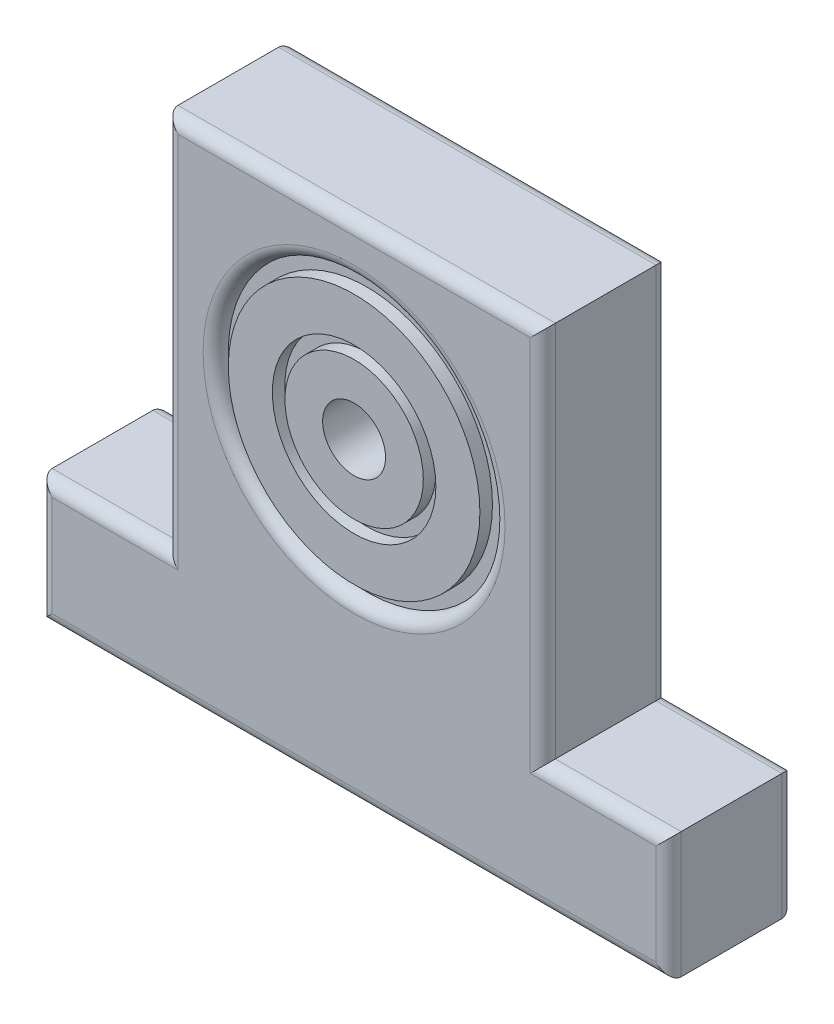
from build123d import *

# Parameters (mm, degrees)
SKETCH1_R           = 2.5
BOSS_EXTRUDE1_DEPTH = 10
SKETCH2_R           = 11
SKETCH2_R_2         = 10
SKETCH2_R_3         = 6.5
SKETCH2_R_4         = 5.5
CUT_EXTRUDE1_DEPTH  = 1
FILLET1_R           = 1


with BuildPart() as part:
    # Sketch1 → Boss-Extrude1 (new body)
    with BuildSketch(Plane.XY):
        Polygon((0, 0), (50, 0), (50, 10), (40, 10), (40, 40), (10, 40), (10, 10), (0, 10), align=None)
        with Locations((25, 25)):
            Circle(SKETCH1_R, mode=Mode.SUBTRACT)
    extrude(amount=BOSS_EXTRUDE1_DEPTH)

    # Sketch2 → Cut-Extrude1 (cut)
    # profile 1 of 2: a face of its own
    with BuildSketch(Plane.XY.offset(10)):
        with Locations((25, 25)):
            Circle(SKETCH2_R)
        with Locations((25, 25)):
            Circle(SKETCH2_R_2, mode=Mode.SUBTRACT)
    # profile 2 of 2: a face of its own
    with BuildSketch(Plane.XY.offset(10)):
        with Locations((25, 25)):
            Circle(SKETCH2_R_3)
        with Locations((25, 25)):
            Circle(SKETCH2_R_4, mode=Mode.SUBTRACT)
    cut_extrude1 = extrude(amount=-CUT_EXTRUDE1_DEPTH, mode=Mode.SUBTRACT)

    # Mirror1: Cut-Extrude1 across plane
    add(cut_extrude1.mirror(Plane.XY.offset(5)), mode=Mode.SUBTRACT)

    # Fillet1
    fillet1_edges = [part.edges().sort_by_distance(p)[0] for p in [
        (45, 10, 0),
        (50, 5, 0),
        (25, 0, 0),
        (0, 5, 0),
        (50, 5, 10),
        (45, 10, 10),
        (40, 25, 10),
        (25, 40, 10),
        (10, 25, 10),
        (14, 25, 10),
        (5, 10, 10),
        (14, 25, 0),
        (0, 5, 10),
        (5, 10, 0),
        (25, 0, 10),
        (10, 25, 0),
        (25, 40, 0),
        (40, 25, 0),
    ]]
    fillet(fillet1_edges, radius=FILLET1_R - 0.0001)  # a hair under: the kernel refuses the full size


solid = part.part
